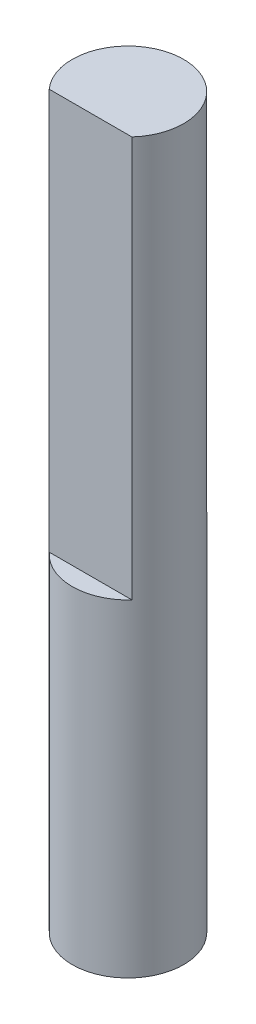
from build123d import *

# Parameters (mm, degrees)
SKETCH1_R           = 2.5019
BOSS_EXTRUDE1_DEPTH = 14.7
BOSS_EXTRUDE2_DEPTH = 18


with BuildPart() as part:
    # Sketch1 → Boss-Extrude1 (new body)
    with BuildSketch(Plane(origin=(0, 0, 0), x_dir=(1, 0, 0), z_dir=(0, 1, 0))):
        Circle(SKETCH1_R)
    extrude(amount=BOSS_EXTRUDE1_DEPTH)

    # Sketch2 → Boss-Extrude2 (add)
    with BuildSketch(Plane(origin=(0, 14.7, 0), x_dir=(1, 0, 0), z_dir=(0, 1, 0))):
        with BuildLine():
            Line((-1.855488361, -1.678292749), (1.855488361, -1.678292749))
            ThreePointArc((1.855488361, -1.678292749), (0, 2.5019), (-1.855488361, -1.678292749))
        make_face()
    extrude(amount=BOSS_EXTRUDE2_DEPTH)


solid = part.part
